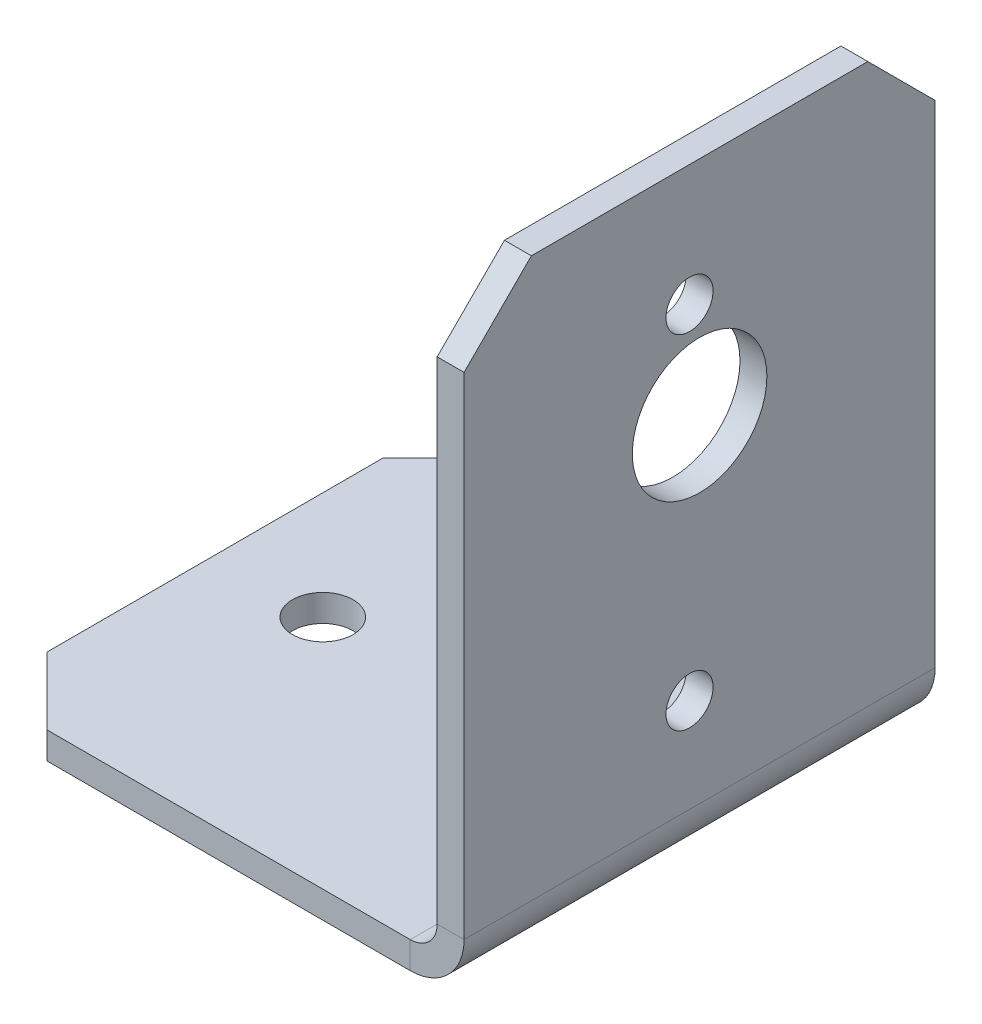
from build123d import *

# Parameters (mm, degrees)
BASE_FLANGE1_DEPTH = 35
SKETCH3_R          = 5
SKETCH3_R_2        = 1.75
CUT_EXTRUDE1_DEPTH = 10
CHAMFER1_SIZE      = 5
SKETCH4_R          = 2.25
CUT_EXTRUDE2_DEPTH = 10


# Sheet-metal steps are written as plain solids
with BuildPart() as part:
    # Sketch1 → Base-Flange1 (new body)
    with BuildSketch(Plane.XY):
        with BuildLine():
            Line((-36, 0), (-4, 0))
            ThreePointArc((-4, 0), (-1.171572875, 1.171572875), (0, 4))
            Line((0, 4), (0, 45.5))
            Line((0, 45.5), (-2, 45.5))
            Line((-2, 45.5), (-2, 4))
            ThreePointArc((-2, 4), (-2.585786438, 2.585786438), (-4, 2))
            Line((-4, 2), (-36, 2))
            Line((-36, 2), (-36, 0))
        make_face()
    extrude(amount=BASE_FLANGE1_DEPTH)

    # Sketch3 → Cut-Extrude1 (cut)
    with BuildSketch(Plane(origin=(0, 0, 0), x_dir=(0, 0, -1), z_dir=(1, 0, 0))):
        with Locations((-17.5, 29)):
            Circle(SKETCH3_R)
        with Locations((-18.25, 11)):
            Circle(SKETCH3_R_2)
        with Locations((-18.25, 36.5)):
            Circle(SKETCH3_R_2)
    extrude(amount=-CUT_EXTRUDE1_DEPTH, mode=Mode.SUBTRACT)

    # Chamfer1
    chamfer1_edges = [part.edges().sort_by_distance(p)[0] for p in [
        (-1, 45.5, 35),
        (-36, 1, 35),
        (-1, 45.5, 0),
        (-36, 1, 0),
    ]]
    chamfer(chamfer1_edges, length=CHAMFER1_SIZE)

    # Sketch4 → Cut-Extrude2 (cut)
    with BuildSketch(Plane.XZ):
        with Locations((-28, 17.5)):
            Circle(SKETCH4_R)
        with Locations((-12, 17.5)):
            Circle(SKETCH4_R)
    extrude(amount=-CUT_EXTRUDE2_DEPTH, mode=Mode.SUBTRACT)


solid = part.part
